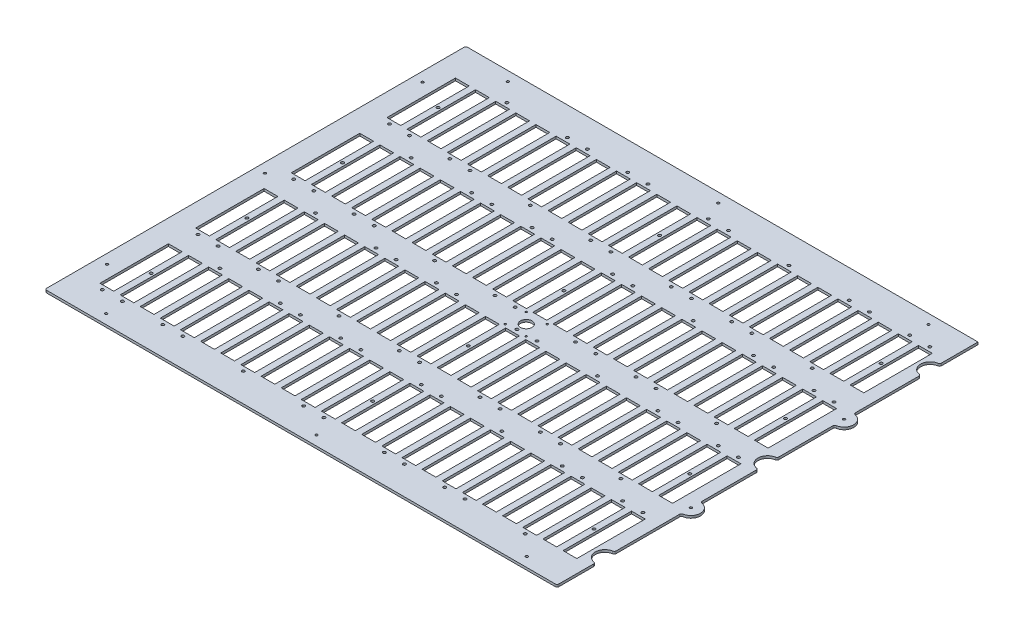
from build123d import *

# Parameters (mm, degrees)
BOSS_EXTRUDE1_DEPTH          = 3.175
SKETCH17_W                   = 18.288
SKETCH17_H                   = 90.932
CUT_EXTRUDE5_DEPTH           = 451.206032887
F_25_0_1495_DIAMETER_HOLE1_D = 3.7973
FILLET1_R                    = 2.54
F_6_CLEARANCE_HOLE1_D        = 3.7973
F_2_CLEARANCE_HOLE1_D        = 2.4384
SKETCH20_R                   = 7.62
CUT_EXTRUDE6_DEPTH           = 451.206032887
F_1_8_0_125_DIAMETER_HOLE1_D = 3.175


with BuildPart() as part:
    # Sketch1 → Boss-Extrude1 (new body)
    with BuildSketch(Plane(origin=(0, 0, 0), x_dir=(1, 0, 0), z_dir=(0, 1, 0))):
        with BuildLine():
            Line((-340.1822, -279.5524), (340.1822, -279.5524))
            Line((340.1822, -279.5524), (340.1822, -228.7524))
            ThreePointArc((340.1822, -228.7524), (327.4822, -216.0524), (340.1822, -203.3524))
            Line((340.1822, -203.3524), (340.1822, -114.4524))
            ThreePointArc((340.1822, -114.4524), (352.8822, -101.7524), (340.1822, -89.0524))
            Line((340.1822, -89.0524), (340.1822, -12.7))
            ThreePointArc((340.1822, -12.7), (327.4822, 0), (340.1822, 12.7))
            Line((340.1822, 12.7), (340.1822, 89.0524))
            ThreePointArc((340.1822, 89.0524), (352.8822, 101.7524), (340.1822, 114.4524))
            Line((340.1822, 114.4524), (340.1822, 203.3524))
            ThreePointArc((340.1822, 203.3524), (327.4822, 216.0524), (340.1822, 228.7524))
            Line((340.1822, 228.7524), (340.1822, 279.5524))
            Line((340.1822, 279.5524), (-340.1822, 279.5524))
            Line((-340.1822, 279.5524), (-340.1822, -279.5524))
        make_face()
    extrude(amount=BOSS_EXTRUDE1_DEPTH)

    # Sketch17 → Cut-Extrude5 (cut, through all)
    with BuildSketch(Plane(origin=(0, 3.175, 0), x_dir=(1, 0, 0), z_dir=(0, 1, 0))):
        with Locations((-274.627008696, 190.6524)):
            Rectangle(SKETCH17_W, SKETCH17_H)
        with Locations((-301.371, 190.6524)):
            Rectangle(SKETCH17_W, SKETCH17_H)
        with Locations((-247.883017391, 190.6524)):
            Rectangle(SKETCH17_W, SKETCH17_H)
        with Locations((-221.139026087, 190.6524)):
            Rectangle(SKETCH17_W, SKETCH17_H)
        with Locations((-194.395034783, 190.6524)):
            Rectangle(SKETCH17_W, SKETCH17_H)
        with Locations((-167.651043478, 190.6524)):
            Rectangle(SKETCH17_W, SKETCH17_H)
        with Locations((-140.907052174, 190.6524)):
            Rectangle(SKETCH17_W, SKETCH17_H)
        with Locations((-114.16306087, 190.6524)):
            Rectangle(SKETCH17_W, SKETCH17_H)
        with Locations((-87.419069565, 190.6524)):
            Rectangle(SKETCH17_W, SKETCH17_H)
        with Locations((-60.675078261, 190.6524)):
            Rectangle(SKETCH17_W, SKETCH17_H)
        with Locations((-33.931086957, 190.6524)):
            Rectangle(SKETCH17_W, SKETCH17_H)
        with Locations((-7.187095652, 190.6524)):
            Rectangle(SKETCH17_W, SKETCH17_H)
        with Locations((19.556895652, 190.6524)):
            Rectangle(SKETCH17_W, SKETCH17_H)
        with Locations((46.300886957, 190.6524)):
            Rectangle(SKETCH17_W, SKETCH17_H)
        with Locations((73.044878261, 190.6524)):
            Rectangle(SKETCH17_W, SKETCH17_H)
        with Locations((99.788869565, 190.6524)):
            Rectangle(SKETCH17_W, SKETCH17_H)
        with Locations((126.53286087, 190.6524)):
            Rectangle(SKETCH17_W, SKETCH17_H)
        with Locations((153.276852174, 190.6524)):
            Rectangle(SKETCH17_W, SKETCH17_H)
        with Locations((180.020843478, 190.6524)):
            Rectangle(SKETCH17_W, SKETCH17_H)
        with Locations((206.764834783, 190.6524)):
            Rectangle(SKETCH17_W, SKETCH17_H)
        with Locations((233.508826087, 190.6524)):
            Rectangle(SKETCH17_W, SKETCH17_H)
        with Locations((260.252817391, 190.6524)):
            Rectangle(SKETCH17_W, SKETCH17_H)
        with Locations((286.996808696, 190.6524)):
            Rectangle(SKETCH17_W, SKETCH17_H)
        with Locations((313.7408, 190.6524)):
            Rectangle(SKETCH17_W, SKETCH17_H)
        with Locations((-274.627008696, 63.5762)):
            Rectangle(SKETCH17_W, SKETCH17_H)
        with Locations((-247.883017391, 63.5762)):
            Rectangle(SKETCH17_W, SKETCH17_H)
        with Locations((-221.139026087, 63.5762)):
            Rectangle(SKETCH17_W, SKETCH17_H)
        with Locations((-194.395034783, 63.5762)):
            Rectangle(SKETCH17_W, SKETCH17_H)
        with Locations((-167.651043478, 63.5762)):
            Rectangle(SKETCH17_W, SKETCH17_H)
        with Locations((-140.907052174, 63.5762)):
            Rectangle(SKETCH17_W, SKETCH17_H)
        with Locations((-114.16306087, 63.5762)):
            Rectangle(SKETCH17_W, SKETCH17_H)
        with Locations((-87.419069565, 63.5762)):
            Rectangle(SKETCH17_W, SKETCH17_H)
        with Locations((-60.675078261, 63.5762)):
            Rectangle(SKETCH17_W, SKETCH17_H)
        with Locations((-33.931086957, 63.5762)):
            Rectangle(SKETCH17_W, SKETCH17_H)
        with Locations((-7.187095652, 63.5762)):
            Rectangle(SKETCH17_W, SKETCH17_H)
        with Locations((19.556895652, 63.5762)):
            Rectangle(SKETCH17_W, SKETCH17_H)
        with Locations((46.300886957, 63.5762)):
            Rectangle(SKETCH17_W, SKETCH17_H)
        with Locations((73.044878261, 63.5762)):
            Rectangle(SKETCH17_W, SKETCH17_H)
        with Locations((99.788869565, 63.5762)):
            Rectangle(SKETCH17_W, SKETCH17_H)
        with Locations((126.53286087, 63.5762)):
            Rectangle(SKETCH17_W, SKETCH17_H)
        with Locations((153.276852174, 63.5762)):
            Rectangle(SKETCH17_W, SKETCH17_H)
        with Locations((180.020843478, 63.5762)):
            Rectangle(SKETCH17_W, SKETCH17_H)
        with Locations((206.764834783, 63.5762)):
            Rectangle(SKETCH17_W, SKETCH17_H)
        with Locations((233.508826087, 63.5762)):
            Rectangle(SKETCH17_W, SKETCH17_H)
        with Locations((260.252817391, 63.5762)):
            Rectangle(SKETCH17_W, SKETCH17_H)
        with Locations((286.996808696, 63.5762)):
            Rectangle(SKETCH17_W, SKETCH17_H)
        with Locations((313.7408, 63.5762)):
            Rectangle(SKETCH17_W, SKETCH17_H)
        with Locations((-274.627008696, -63.5)):
            Rectangle(SKETCH17_W, SKETCH17_H)
        with Locations((-247.883017391, -63.5)):
            Rectangle(SKETCH17_W, SKETCH17_H)
        with Locations((-221.139026087, -63.5)):
            Rectangle(SKETCH17_W, SKETCH17_H)
        with Locations((-194.395034783, -63.5)):
            Rectangle(SKETCH17_W, SKETCH17_H)
        with Locations((-167.651043478, -63.5)):
            Rectangle(SKETCH17_W, SKETCH17_H)
        with Locations((-140.907052174, -63.5)):
            Rectangle(SKETCH17_W, SKETCH17_H)
        with Locations((-114.16306087, -63.5)):
            Rectangle(SKETCH17_W, SKETCH17_H)
        with Locations((-87.419069565, -63.5)):
            Rectangle(SKETCH17_W, SKETCH17_H)
        with Locations((-60.675078261, -63.5)):
            Rectangle(SKETCH17_W, SKETCH17_H)
        with Locations((-33.931086957, -63.5)):
            Rectangle(SKETCH17_W, SKETCH17_H)
        with Locations((-7.187095652, -63.5)):
            Rectangle(SKETCH17_W, SKETCH17_H)
        with Locations((19.556895652, -63.5)):
            Rectangle(SKETCH17_W, SKETCH17_H)
        with Locations((46.300886957, -63.5)):
            Rectangle(SKETCH17_W, SKETCH17_H)
        with Locations((73.044878261, -63.5)):
            Rectangle(SKETCH17_W, SKETCH17_H)
        with Locations((99.788869565, -63.5)):
            Rectangle(SKETCH17_W, SKETCH17_H)
        with Locations((126.53286087, -63.5)):
            Rectangle(SKETCH17_W, SKETCH17_H)
        with Locations((153.276852174, -63.5)):
            Rectangle(SKETCH17_W, SKETCH17_H)
        with Locations((180.020843478, -63.5)):
            Rectangle(SKETCH17_W, SKETCH17_H)
        with Locations((206.764834783, -63.5)):
            Rectangle(SKETCH17_W, SKETCH17_H)
        with Locations((233.508826087, -63.5)):
            Rectangle(SKETCH17_W, SKETCH17_H)
        with Locations((260.252817391, -63.5)):
            Rectangle(SKETCH17_W, SKETCH17_H)
        with Locations((286.996808696, -63.5)):
            Rectangle(SKETCH17_W, SKETCH17_H)
        with Locations((313.7408, -63.5)):
            Rectangle(SKETCH17_W, SKETCH17_H)
        with Locations((-274.627008696, -190.5762)):
            Rectangle(SKETCH17_W, SKETCH17_H)
        with Locations((-247.883017391, -190.5762)):
            Rectangle(SKETCH17_W, SKETCH17_H)
        with Locations((-221.139026087, -190.5762)):
            Rectangle(SKETCH17_W, SKETCH17_H)
        with Locations((-194.395034783, -190.5762)):
            Rectangle(SKETCH17_W, SKETCH17_H)
        with Locations((-167.651043478, -190.5762)):
            Rectangle(SKETCH17_W, SKETCH17_H)
        with Locations((-140.907052174, -190.5762)):
            Rectangle(SKETCH17_W, SKETCH17_H)
        with Locations((-114.16306087, -190.5762)):
            Rectangle(SKETCH17_W, SKETCH17_H)
        with Locations((-87.419069565, -190.5762)):
            Rectangle(SKETCH17_W, SKETCH17_H)
        with Locations((-60.675078261, -190.5762)):
            Rectangle(SKETCH17_W, SKETCH17_H)
        with Locations((-33.931086957, -190.5762)):
            Rectangle(SKETCH17_W, SKETCH17_H)
        with Locations((-7.187095652, -190.5762)):
            Rectangle(SKETCH17_W, SKETCH17_H)
        with Locations((19.556895652, -190.5762)):
            Rectangle(SKETCH17_W, SKETCH17_H)
        with Locations((46.300886957, -190.5762)):
            Rectangle(SKETCH17_W, SKETCH17_H)
        with Locations((73.044878261, -190.5762)):
            Rectangle(SKETCH17_W, SKETCH17_H)
        with Locations((99.788869565, -190.5762)):
            Rectangle(SKETCH17_W, SKETCH17_H)
        with Locations((126.53286087, -190.5762)):
            Rectangle(SKETCH17_W, SKETCH17_H)
        with Locations((153.276852174, -190.5762)):
            Rectangle(SKETCH17_W, SKETCH17_H)
        with Locations((180.020843478, -190.5762)):
            Rectangle(SKETCH17_W, SKETCH17_H)
        with Locations((206.764834783, -190.5762)):
            Rectangle(SKETCH17_W, SKETCH17_H)
        with Locations((233.508826087, -190.5762)):
            Rectangle(SKETCH17_W, SKETCH17_H)
        with Locations((260.252817391, -190.5762)):
            Rectangle(SKETCH17_W, SKETCH17_H)
        with Locations((286.996808696, -190.5762)):
            Rectangle(SKETCH17_W, SKETCH17_H)
        with Locations((313.7408, -190.5762)):
            Rectangle(SKETCH17_W, SKETCH17_H)
        with Locations((-301.371, 63.5762)):
            Rectangle(SKETCH17_W, SKETCH17_H)
        with Locations((-301.371, -63.5)):
            Rectangle(SKETCH17_W, SKETCH17_H)
        with Locations((-301.371, -190.5762)):
            Rectangle(SKETCH17_W, SKETCH17_H)
    extrude(amount=-CUT_EXTRUDE5_DEPTH, mode=Mode.SUBTRACT)

    # #25 (0.1495) Diameter Hole1 (through all)
    with Locations(Plane(origin=(0, 3.175, 0), x_dir=(1, 0, 0), z_dir=(0, 1, 0))):
        with Locations((-301.523398222, 139.3444), (313.7408, -139.2682), (286.990182686, -139.2682), (260.239565372, -241.8842), (233.488948058, -139.2682), (206.738330744, -139.2682), (179.98771343, -241.8842), (153.237096116, -241.8842), (126.486478802, -139.2682), (99.735861488, -241.8842), (72.985244174, -241.8842), (46.23462686, -139.2682), (19.484009546, -139.2682), (-7.266607768, -241.8842), (-34.017225082, -241.8842), (-60.767842396, -139.2682), (-87.51845971, -139.2682), (-114.269077024, -241.8842), (-141.019694338, -139.2682), (-167.770311652, -139.2682), (-194.520928966, -241.8842), (-221.27154628, -241.8842), (-248.022163594, -139.2682), (-274.772780908, -241.8842), (-301.523398222, -241.8842), (313.7408, -12.192), (286.990182686, -12.192), (260.239565372, -114.808), (233.488948058, -12.192), (206.738330744, -12.192), (179.98771343, -114.808), (153.237096116, -114.808), (126.486478802, -12.192), (99.735861488, -114.808), (72.985244174, -114.808), (46.23462686, -12.192), (19.484009546, -12.192), (-7.266607768, -114.808), (-34.017225082, -114.808), (-60.767842396, -12.192), (-87.51845971, -12.192), (-114.269077024, -114.808), (-141.019694338, -12.192), (-167.770311652, -12.192), (-194.520928966, -114.808), (-221.27154628, -114.808), (-248.022163594, -12.192), (-274.772780908, -114.808), (-301.523398222, -114.808), (313.7408, 114.8842), (286.990182686, 114.8842), (260.239565372, 12.2682), (233.488948058, 114.8842), (206.738330744, 114.8842), (179.98771343, 12.2682), (153.237096116, 12.2682), (126.486478802, 114.8842), (99.735861488, 12.2682), (72.985244174, 12.2682), (46.23462686, 114.8842), (19.484009546, 114.8842), (-7.266607768, 12.2682), (-34.017225082, 12.2682), (-60.767842396, 114.8842), (-87.51845971, 114.8842), (-114.269077024, 12.2682), (-141.019694338, 114.8842), (-167.770311652, 114.8842), (-194.520928966, 12.2682), (-221.27154628, 12.2682), (-248.022163594, 114.8842), (-274.772780908, 12.2682), (-301.523398222, 12.2682), (313.7408, 241.9604), (286.990182686, 241.9604), (260.239565372, 139.3444), (233.488948058, 241.9604), (206.738330744, 241.9604), (179.98771343, 139.3444), (153.237096116, 139.3444), (126.486478802, 241.9604), (99.735861488, 139.3444), (72.985244174, 139.3444), (46.23462686, 241.9604), (19.484009546, 241.9604), (-7.266607768, 139.3444), (-34.017225082, 139.3444), (-60.767842396, 241.9604), (-87.51845971, 241.9604), (-114.269077024, 139.3444), (-141.019694338, 241.9604), (-167.770311652, 241.9604), (-194.520928966, 139.3444), (-221.27154628, 139.3444), (-248.022163594, 241.9604), (-274.772780908, 139.3444)):
            Hole(F_25_0_1495_DIAMETER_HOLE1_D / 2)

    # Fillet1
    fillet1_edges = [part.edges().sort_by_distance(p)[0] for p in [
        (-340.1822, 1.5875, -279.5524),
        (-340.1822, 1.5875, 279.5524),
        (340.1822, 1.5875, 279.5524),
        (340.1822, 1.5875, 203.3524),
        (340.1822, 1.5875, 228.7524),
        (340.1822, 1.5875, -228.7524),
        (340.1822, 1.5875, -203.3524),
        (340.1822, 1.5875, -114.4524),
        (340.1822, 1.5875, -89.0524),
        (340.1822, 1.5875, -12.7),
        (340.1822, 1.5875, 12.7),
        (340.1822, 1.5875, 89.0524),
        (340.1822, 1.5875, 114.4524),
    ]]
    fillet(fillet1_edges, radius=FILLET1_R)

    # #6 Clearance Hole1 (through all)
    with Locations(Plane(origin=(0, 3.175, 0), x_dir=(1, 0, 0), z_dir=(0, 1, 0))):
        with Locations((300.368804348, -190.5762), (-287.999004348, 190.6524), (6.1849, 190.6524), (300.368804348, 190.6524), (-287.999004348, 63.5762), (6.1849, 63.5762), (300.368804348, 63.5762), (-287.999004348, -63.5), (6.1849, -63.5), (300.368804348, -63.5), (-287.999004348, -190.5762), (6.1849, -190.5762)):
            Hole(F_6_CLEARANCE_HOLE1_D / 2)

    # #2 Clearance Hole1 (through all)
    with Locations(Plane(origin=(0, 3.175, 0), x_dir=(1, 0, 0), z_dir=(0, 1, 0))):
        with Locations((33.5661, 14.0081), (5.6261, 14.0081), (5.6261, -13.9319), (33.5661, -13.9319)):
            Hole(F_2_CLEARANCE_HOLE1_D / 2)

    # Sketch20 → Cut-Extrude6 (cut, through all)
    with BuildSketch(Plane(origin=(0, 3.175, 0), x_dir=(1, 0, 0), z_dir=(0, 1, 0))):
        with Locations((19.5961, 0.0381)):
            Circle(SKETCH20_R)
    extrude(amount=-CUT_EXTRUDE6_DEPTH, mode=Mode.SUBTRACT)

    # 1/8 (0.125) Diameter Hole1 (through all)
    with Locations(Plane(origin=(0, 3.175, 0), x_dir=(1, 0, 0), z_dir=(0, 1, 0))):
        with Locations((287.274, -266.8524), (287.274, 266.8524), (7.874, 266.8524), (-271.526, 266.8524), (-327.5584, 209.55), (-327.5584, 0), (-327.5584, -209.55), (-271.526, -266.8524), (7.874, -266.8524), (340.1822, 101.7524), (340.1822, -101.7524)):
            Hole(F_1_8_0_125_DIAMETER_HOLE1_D / 2)


solid = part.part
